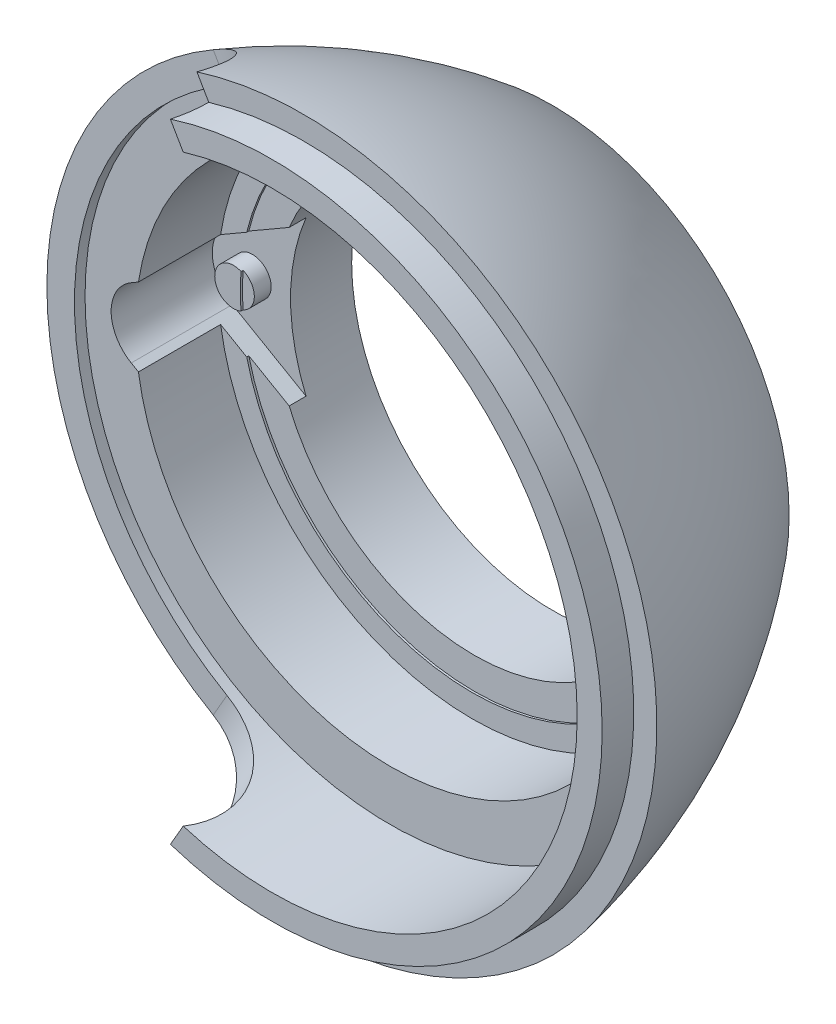
from build123d import *

# Parameters (mm, degrees)
SKETCH58_R                      = 36.2585
CUT_EXTRUDE8_DEPTH              = 24
CUT_EXTRUDE22_START             = -0.3
SKETCH74_R                      = 33.02
SKETCH74_R_2                    = 26.611122565
CUT_EXTRUDE22_DEPTH             = 0.3
SKETCH59_R                      = 28.575
CUT_EXTRUDE9_DEPTH              = 25.5
SKETCH63_R                      = 2.667
CUT_EXTRUDE11_DEPTH             = 2.7
CUT_EXTRUDE17_REACH             = 78.6
SKETCH63_7_R                    = 2.667
CUT_EXTRUDE17_DIRECTION_2_DEPTH = 2.54
CUT_EXTRUDE18_REACH             = 78.6
SKETCH63_8_R                    = 2.667
SKETCH71_R                      = 10.795
CUT_EXTRUDE21_DEPTH             = 57.912
SKETCH72_W                      = 24.208976154
SKETCH72_H                      = 12.99632803
CUT_REVOLVE3_ANGLE              = 120


with BuildPart() as part:
    # Sketch2 → Revolve2 (revolve)
    with BuildSketch(Plane(origin=(0, 0, 0), x_dir=(0, 0, -1), z_dir=(1, 0, 0))):
        with BuildLine():
            Line((28.048, 26.611122565), (51.148, 26.611122565))
            Line((51.148, 26.611122565), (51.148, 33.704983655))
            ThreePointArc((51.148, 33.704983655), (34.458915514, 44.150003706), (15.748, 50.275820015))
            Line((15.748, 50.275820015), (15.748, 46.99))
            Line((15.748, 46.99), (11.248, 46.99))
            Line((11.248, 46.99), (11.248, 43.434))
            Line((11.248, 43.434), (15.748, 43.434))
            Line((15.748, 43.434), (28.048, 43.434))
            Line((28.048, 43.434), (28.048, 26.611122565))
        make_face()
    revolve(axis=Axis((0, 0, 53.897463865), (0, 0, -1)))

    # Sketch58 → Cut-Extrude8 (cut)
    with BuildSketch(Plane.XY.offset(-15.748)):
        Circle(SKETCH58_R)
    extrude(amount=-CUT_EXTRUDE8_DEPTH, mode=Mode.SUBTRACT)

    # Sketch74 → Cut-Extrude22 (cut)
    with BuildSketch(Plane.XY.offset(-39.748).offset(CUT_EXTRUDE22_START)):
        Circle(SKETCH74_R)
        Circle(SKETCH74_R_2, mode=Mode.SUBTRACT)
    extrude(amount=CUT_EXTRUDE22_DEPTH, mode=Mode.SUBTRACT)

    # Sketch59 → Cut-Extrude9 (cut)
    with BuildSketch(Plane.XY.offset(-39.748)):
        Circle(SKETCH59_R)
    extrude(amount=-CUT_EXTRUDE9_DEPTH, mode=Mode.SUBTRACT)

    # Sketch63 → Cut-Extrude11 (cut)
    with BuildSketch(Plane.XY.offset(-39.748)):
        with BuildLine():
            Line((-36.8575, 4.949335183), (-26.371478487, 11.003442526))
            ThreePointArc((-26.371478487, 11.003442526), (-28.575, 0), (-26.371478487, -11.003442526))
            Line((-26.371478487, -11.003442526), (-36.8575, -4.949335183))
            ThreePointArc((-36.8575, -4.949335183), (-39.715, 0), (-36.8575, 4.949335183))
        make_face()
        with Locations((-34, 0)):
            Circle(SKETCH63_R, mode=Mode.SUBTRACT)
    cut_extrude11 = extrude(amount=-CUT_EXTRUDE11_DEPTH, mode=Mode.SUBTRACT)

    # Sketch63<7> → Cut-Extrude17 (cut, up to next)
    with BuildSketch(Plane.XY.offset(-39.748), mode=Mode.PRIVATE) as cut_extrude17_sk1:
        with BuildLine():
            Line((-36.8575, 4.949335183), (-26.371478487, 11.003442526))
            ThreePointArc((-26.371478487, 11.003442526), (-28.575, 0), (-26.371478487, -11.003442526))
            Line((-26.371478487, -11.003442526), (-36.8575, -4.949335183))
            ThreePointArc((-36.8575, -4.949335183), (-39.715, 0), (-36.8575, 4.949335183))
        make_face()
        with Locations((-34, 0)):
            Circle(SKETCH63_7_R, mode=Mode.SUBTRACT)
    cut_extrude17_tool1 = extrude(cut_extrude17_sk1.sketch, amount=CUT_EXTRUDE17_REACH, mode=Mode.PRIVATE) & part.part
    cut_extrude17 = cut_extrude17_tool1.solids().sort_by_distance((-31.485808, -7.753507, -39.748))[0]
    add(cut_extrude17, mode=Mode.SUBTRACT)

    # Sketch63<7> → Cut-Extrude17 direction 2 (cut)
    with BuildSketch(Plane.XY.offset(-39.748)):
        with BuildLine():
            Line((-36.8575, 4.949335183), (-26.371478487, 11.003442526))
            ThreePointArc((-26.371478487, 11.003442526), (-28.575, 0), (-26.371478487, -11.003442526))
            Line((-26.371478487, -11.003442526), (-36.8575, -4.949335183))
            ThreePointArc((-36.8575, -4.949335183), (-39.715, 0), (-36.8575, 4.949335183))
        make_face()
        with Locations((-34, 0)):
            Circle(SKETCH63_7_R, mode=Mode.SUBTRACT)
    cut_extrude17_direction_2 = extrude(amount=-CUT_EXTRUDE17_DIRECTION_2_DEPTH, mode=Mode.SUBTRACT)

    # Sketch63<8> → Cut-Extrude18 (cut, up to next)
    with BuildSketch(Plane.XY.offset(-39.748), mode=Mode.PRIVATE) as cut_extrude18_sk1:
        with Locations((-34, 0)):
            Circle(SKETCH63_8_R)
    cut_extrude18_tool1 = extrude(cut_extrude18_sk1.sketch, amount=CUT_EXTRUDE18_REACH, mode=Mode.PRIVATE) & part.part
    cut_extrude18 = cut_extrude18_tool1.solids().sort_by_distance((-34, 0, -39.748))[0]
    add(cut_extrude18, mode=Mode.SUBTRACT)

    # Mirror2: Cut-Extrude11, Cut-Extrude17, Cut-Extrude17 direction 2, Cut-Extrude18 across plane
    add(cut_extrude11.mirror(Plane(origin=(0, 0, 0), x_dir=(0, 0, 1), z_dir=(1, 0, 0))), mode=Mode.SUBTRACT)
    add(cut_extrude17.mirror(Plane(origin=(0, 0, 0), x_dir=(0, 0, 1), z_dir=(1, 0, 0))), mode=Mode.SUBTRACT)
    add(cut_extrude17_direction_2.mirror(Plane(origin=(0, 0, 0), x_dir=(0, 0, 1), z_dir=(1, 0, 0))), mode=Mode.SUBTRACT)
    add(cut_extrude18.mirror(Plane(origin=(0, 0, 0), x_dir=(0, 0, 1), z_dir=(1, 0, 0))), mode=Mode.SUBTRACT)

    # Sketch71 → Cut-Extrude21 (cut)
    with BuildSketch(Plane(origin=(0, 0, 0), x_dir=(-0.8660254037844416, -0.49999999999999495, 0), z_dir=(0.49999999999999495, -0.8660254037844416, 0))):
        with Locations((0, 15.748)):
            Circle(SKETCH71_R)
    cut_extrude21 = extrude(amount=-CUT_EXTRUDE21_DEPTH, mode=Mode.SUBTRACT)

    # Mirror4: Cut-Extrude21 across plane
    add(cut_extrude21.mirror(Plane.ZX), mode=Mode.SUBTRACT)

    # Sketch72 → Cut-Revolve3 (revolve, cut)
    with BuildSketch(Plane(origin=(0, 0, 0), x_dir=(0, 0, -1), z_dir=(-0.8660254037844416, -0.49999999999999495, 0))):
        with Locations((14.438511923, -45.327752816)):
            Rectangle(SKETCH72_W, SKETCH72_H)
    revolve(axis=Axis((0, 0, -9.245), (0, 0, 1)), revolution_arc=CUT_REVOLVE3_ANGLE, mode=Mode.SUBTRACT)


solid = part.part
